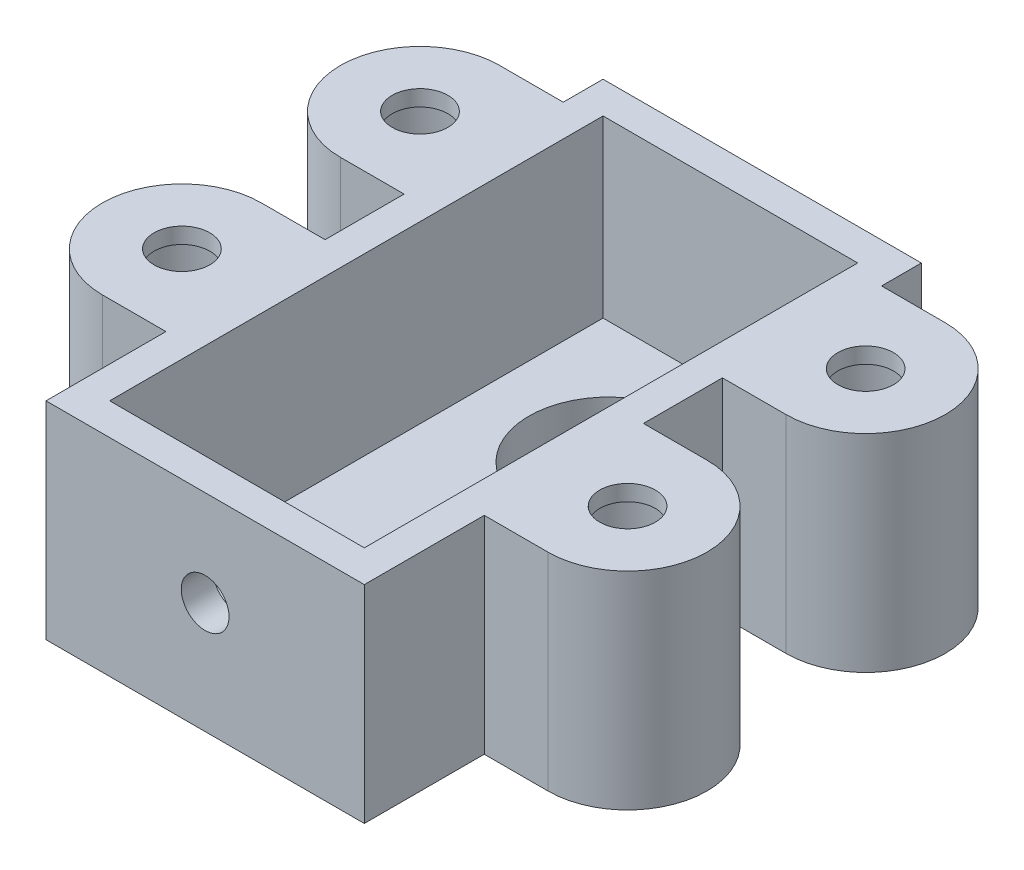
from build123d import *

# Parameters (mm, degrees)
SKETCH1_W              = 20
SKETCH1_H              = 35
SKETCH1_R              = 5
SKETCH1_R_2            = 1.1
BOSS_EXTRUDE1_DEPTH    = 13
SKETCH5_W              = 16
SKETCH5_H              = 31
CUT_EXTRUDE1_DEPTH     = 11
CUT_EXTRUDE2_REACH     = 40.652
SKETCH7_R              = 1.5
BOSS_EXTRUDE3_DEPTH    = 13
SKETCH11_R             = 3.25
CUT_EXTRUDE4_DEPTH     = 12
CUT_EXTRUDE5_START     = 12
CUT_EXTRUDE5_OUTLINE_R = 1.75
CUT_EXTRUDE5_DEPTH     = 1


# Read off the part's stored shape, not the designer's step: Cut-Extrude5
with BuildPart() as part:
    # Sketch1 → Boss-Extrude1 (new body)
    with BuildSketch(Plane(origin=(0, 0, 0), x_dir=(1, 0, 0), z_dir=(0, 1, 0))):
        with Locations((0, -7.840328725)):
            Rectangle(SKETCH1_W, SKETCH1_H)
        with Locations(Location((0, 0, 0), (0, 0, 90))):
            Circle(SKETCH1_R, mode=Mode.SUBTRACT)
        with Locations(Location((6.35, 0, 0), (0, 0, 90))):
            Circle(SKETCH1_R_2, mode=Mode.SUBTRACT)
    extrude(amount=BOSS_EXTRUDE1_DEPTH)

    # Sketch5 → Cut-Extrude1 (cut)
    with BuildSketch(Plane(origin=(0, 13, 0), x_dir=(1, 0, 0), z_dir=(0, 1, 0))):
        with Locations((0, -7.840328725)):
            Rectangle(SKETCH5_W, SKETCH5_H)
    extrude(amount=-CUT_EXTRUDE1_DEPTH, mode=Mode.SUBTRACT)

    # Sketch7 → Cut-Extrude2 (cut, up to next)
    with BuildSketch(Plane.XY.offset(25.340328725), mode=Mode.PRIVATE) as cut_extrude2_sk1:
        with Locations((0, 7)):
            Circle(SKETCH7_R)
    cut_extrude2_tool1 = extrude(cut_extrude2_sk1.sketch, amount=-CUT_EXTRUDE2_REACH, mode=Mode.PRIVATE) & part.part
    add(cut_extrude2_tool1.solids().sort_by_distance((0, 7, 25.340329))[0], mode=Mode.SUBTRACT)

    # Sketch9 → Boss-Extrude3 (add, through all)
    with BuildSketch(Plane(origin=(0, 13, 0), x_dir=(1, 0, 0), z_dir=(0, 1, 0))):
        with BuildLine():
            Line((-14, 7.159671275), (-10, 7.159671275))
            Line((-10, 7.159671275), (-10, -2.840328725))
            Line((-10, -2.840328725), (-14, -2.840328725))
            ThreePointArc((-14, -2.840328725), (-19, 2.159671275), (-14, 7.159671275))
        make_face()
        with BuildLine():
            Line((-14, -7.804369497), (-10, -7.804369497))
            Line((-10, -7.804369497), (-10, -17.804369497))
            Line((-10, -17.804369497), (-14, -17.804369497))
            ThreePointArc((-14, -17.804369497), (-19, -12.804369497), (-14, -7.804369497))
        make_face()
        with BuildLine():
            Line((10, -7.804369497), (10, -17.804369497))
            Line((10, -17.804369497), (14, -17.804369497))
            ThreePointArc((14, -17.804369497), (19, -12.804369497), (14, -7.804369497))
            Line((14, -7.804369497), (10, -7.804369497))
        make_face()
        with BuildLine():
            Line((10, 7.159671275), (10, -2.840328725))
            Line((10, -2.840328725), (14, -2.840328725))
            ThreePointArc((14, -2.840328725), (19, 2.159671275), (14, 7.159671275))
            Line((14, 7.159671275), (10, 7.159671275))
        make_face()
    extrude(amount=-BOSS_EXTRUDE3_DEPTH)

    # Sketch11 → Cut-Extrude4 (cut)
    with BuildSketch(Plane.XZ):
        with Locations(Location((-14, 12.800328725, 0), (0, 0, 270))):
            Circle(SKETCH11_R)
        with Locations(Location((-14, -2.159671275, 0), (0, 0, 270))):
            Circle(SKETCH11_R)
        with Locations(Location((14, 12.800328725, 0), (0, 0, 270))):
            Circle(SKETCH11_R)
        with Locations(Location((14, -2.159671275, 0), (0, 0, 270))):
            Circle(SKETCH11_R)
    extrude(amount=-CUT_EXTRUDE4_DEPTH, mode=Mode.SUBTRACT)

    # Cut-Extrude5 outline → Cut-Extrude5 (cut)
    with BuildSketch(Plane(origin=(0, 0, 0), x_dir=(1, 0, 0), z_dir=(0, 1, 0)).offset(CUT_EXTRUDE5_START)):
        with Locations((-14, 2.159671275)):
            Circle(CUT_EXTRUDE5_OUTLINE_R)
        with Locations((14, -12.800328725)):
            Circle(CUT_EXTRUDE5_OUTLINE_R)
        with Locations((14, 2.159671275)):
            Circle(CUT_EXTRUDE5_OUTLINE_R)
        with Locations((-14, -12.800328725)):
            Circle(CUT_EXTRUDE5_OUTLINE_R)
    extrude(amount=CUT_EXTRUDE5_DEPTH, mode=Mode.SUBTRACT)


solid = part.part
